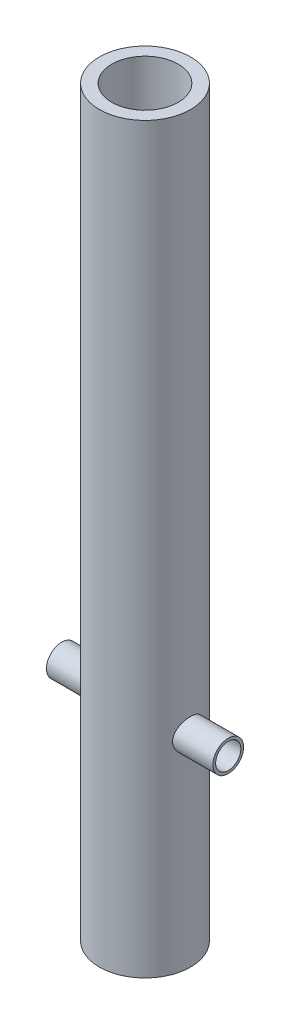
from build123d import *

# Parameters (mm, degrees)
SWEEP_THIN1_PROFILE_R   = 16.7
SWEEP_THIN1_PROFILE_R_2 = 12.15
CUT_EXTRUDE1_START      = -22763.271956421
CUT_EXTRUDE1_OUTLINE_R  = 5.625
CUT_EXTRUDE1_DEPTH      = 33.400000142
SWEEP_THIN4_PROFILE_R   = 5.625
SWEEP_THIN4_PROFILE_R_2 = 4.625
CIRPATTERN2_COUNT       = 2


# Read off the part's stored shape, not the designer's step: Cut-Extrude1
with BuildPart() as part:
    # Sweep-Thin1: sweep along a curve in space
    with BuildLine() as sweep_thin1_path:
        Line((-22746.559814756, -2357.386486381, 40492.090937525), (-22746.559814756, -2085.286486381, 40492.090937525))
    # Sweep-Thin1 profile (on start of the path) → Sweep-Thin1 (sweep)
    with BuildSketch(Plane(origin=(-22746.559814756, -2357.386486381, 40492.090937525), x_dir=(0, 0, 1), z_dir=(0, 1, 0))):
        Circle(SWEEP_THIN1_PROFILE_R)
        Circle(SWEEP_THIN1_PROFILE_R_2, mode=Mode.SUBTRACT)
    sweep(path=sweep_thin1_path.line)

    # Cut-Extrude1 outline → Cut-Extrude1 (cut)
    with BuildSketch(Plane(origin=(0, 0, 0), x_dir=(0, 1, 0), z_dir=(0.999999999999955, 0, -2.9985101835401e-07)).offset(CUT_EXTRUDE1_START)):
        with Locations((-2283.486486381, 40492.084116944)):
            Circle(CUT_EXTRUDE1_OUTLINE_R)
    extrude(amount=CUT_EXTRUDE1_DEPTH, mode=Mode.SUBTRACT)


with BuildPart() as body_2:
    # Sweep-Thin4: sweep along a curve in space
    with BuildLine() as sweep_thin4_path:
        Line((-22731.059814756, -2283.486486381, 40492.090937525), (-22716.059814756, -2283.486486381, 40492.090937525))
    # Sweep-Thin4 profile (on start of the path) → Sweep-Thin4 (sweep)
    with BuildSketch(Plane(origin=(-22731.059814756, -2283.486486381, 40492.090937525), x_dir=(0, 0, 1), z_dir=(1, 0, 0))):
        Circle(SWEEP_THIN4_PROFILE_R)
        Circle(SWEEP_THIN4_PROFILE_R_2, mode=Mode.SUBTRACT)
    sweep(path=sweep_thin4_path.line)


with BuildPart() as cirpattern2_1:
    # CirPattern2: pattern copy
    add(body_2.part.rotate(Axis((-22746.559814756, 0, 40492.090937525), (0, 1, 0)), 1 * 360 / CIRPATTERN2_COUNT))


solid = Compound([part.part, body_2.part, cirpattern2_1.part])
